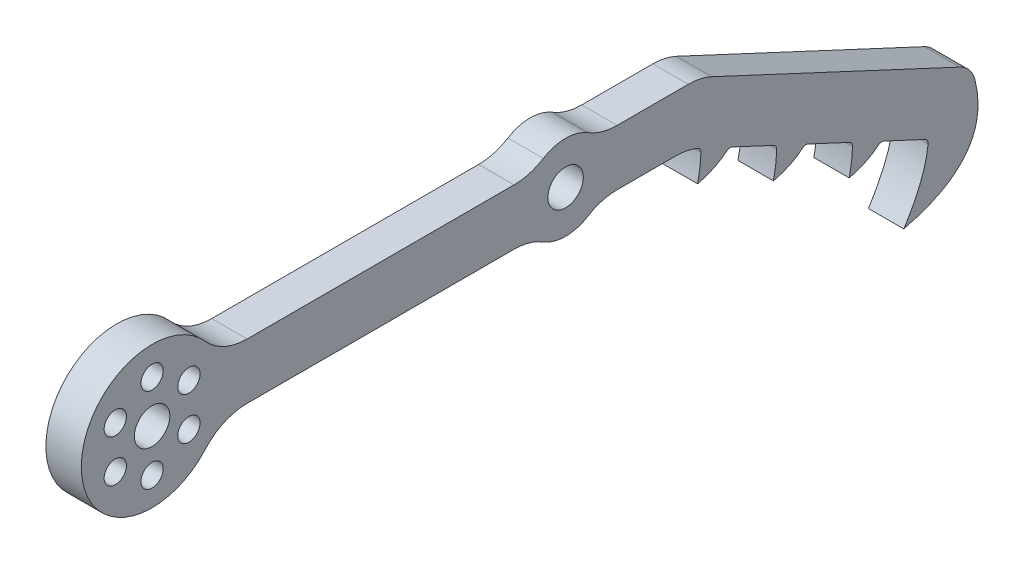
from build123d import *

# Parameters (mm, degrees)
BOSS_EXTRUDE1_DEPTH        = 6.35
F_1_4_0_2500_DOWEL_HOLE4_D = 6.35
FILLET1_R                  = 10
FILLET2_R                  = 10
FILLET4_R                  = 5
FILLET5_R                  = 1
FILLET6_R                  = 10
F_4_0MM_DOWEL_HOLE1_D      = 4
CIRPATTERN1_COUNT          = 6


with BuildPart() as part:
    # Sketch1 → Boss-Extrude1 (new body)
    with BuildSketch(Plane(origin=(0, 0, 0), x_dir=(0, 0, -1), z_dir=(1, 0, 0))):
        with BuildLine():
            Line((-28.374994089, 49.86223243), (28.354545267, 49.86223243))
            ThreePointArc((28.354545267, 49.86223243), (34.104710482, 47.24223243), (39.854875697, 49.86223243))
            Line((39.854875697, 49.86223243), (56.104710487, 49.86223243))
            Line((56.104710487, 49.86223243), (58.379362515, 48.80154477))
            add(Edge.make_bspline(
                [(58.379362515, 48.80154477), (58.386228757, 46.363071997), (57.773854653, 43.567008128)],
                knots=[0, 0, 0, 1, 1, 1], degree=2))
            add(Edge.make_bspline(
                [(63.433148606, 46.444925613), (61.354068213, 44.407555536), (57.773854653, 43.567008128)],
                knots=[0.61808465, 0.61808465, 0.61808465, 1, 1, 1], degree=2))
            Line((63.433148606, 46.444925613), (71.973979321, 42.462270844))
            add(Edge.make_bspline(
                [(71.973979321, 42.462270844), (71.980845562, 40.023798071), (71.368471459, 37.227734202)],
                knots=[0, 0, 0, 1, 1, 1], degree=2))
            add(Edge.make_bspline(
                [(77.027765412, 40.105651687), (74.948685018, 38.06828161), (71.368471459, 37.227734202)],
                knots=[0.61808465, 0.61808465, 0.61808465, 1, 1, 1], degree=2))
            Line((77.027765412, 40.105651687), (85.568596126, 36.122996918))
            add(Edge.make_bspline(
                [(85.568596126, 36.122996918), (85.575462368, 33.684524145), (84.963088264, 30.888460276)],
                knots=[0, 0, 0, 1, 1, 1], degree=2))
            add(Edge.make_bspline(
                [(90.622382217, 33.766377761), (88.543301824, 31.729007684), (84.963088264, 30.888460276)],
                knots=[0.61808465, 0.61808465, 0.61808465, 1, 1, 1], degree=2))
            Line((90.622382217, 33.766377761), (99.163212932, 29.783722992))
            add(Edge.make_bspline(
                [(99.163212932, 29.783722992), (98.939072146, 24.65005498), (94.755179462, 18.075155142)],
                knots=[0, 0, 0, 1, 1, 1], degree=2))
            add(Edge.make_bspline(
                [(94.755179462, 18.075155142), (112.208752339, 22.33534385), (106.773416656, 37.268805905)],
                knots=[0.444949083, 0.444949083, 0.444949083, 1.444949083, 1.444949083, 1.444949083], degree=2))
            Line((106.773416656, 37.268805905), (58.321657114, 59.86223243))
            Line((58.321657114, 59.86223243), (39.854875697, 59.86223243))
            ThreePointArc((39.854875697, 59.86223243), (34.104710482, 62.48223243), (28.354545266, 59.86223243))
            Line((28.354545266, 59.86223243), (-28.374994089, 59.86223243))
            ThreePointArc((-28.374994089, 59.86223243), (-52.749324906, 54.86223243), (-28.374994089, 49.86223243))
        make_face()
    extrude(amount=BOSS_EXTRUDE1_DEPTH)

    # 1/4 (0.2500) Dowel Hole4 (through all)
    with Locations(Plane(origin=(6.35, 0, 0), x_dir=(0, 0, -1), z_dir=(1, 0, 0))):
        with Locations((-40.049324906, 54.86223243), (34.104710482, 54.86223243)):
            Hole(F_1_4_0_2500_DOWEL_HOLE4_D / 2)

    # Fillet1
    fillet1_edges = [part.edges().sort_by_distance(p)[0] for p in [
        (3.175, 59.86223243, 28.374994089),
        (3.175, 49.86223243, 28.374994089),
    ]]
    fillet(fillet1_edges, radius=FILLET1_R)

    # Fillet2
    fillet2_edges = [part.edges().sort_by_distance(p)[0] for p in [
        (3.175, 49.86223243, -56.104710487),
        (3.175, 59.86223243, -58.321657114),
    ]]
    fillet(fillet2_edges, radius=FILLET2_R)

    # Fillet4
    fillet4_edges = [part.edges().sort_by_distance(p)[0] for p in [
        (3.175, 37.268805905, -106.773416656),
    ]]
    fillet(fillet4_edges, radius=FILLET4_R)

    # Fillet5
    fillet5_edges = [part.edges().sort_by_distance(p)[0] for p in [
        (3.175, 33.766377761, -90.622382217),
        (3.175, 40.105651687, -77.027765412),
        (3.175, 46.444925613, -63.433148606),
        (3.175, 48.80154477, -58.379362515),
        (3.175, 42.462270844, -71.973979321),
        (3.175, 36.122996918, -85.568596126),
        (3.175, 29.783722992, -99.163212932),
    ]]
    fillet(fillet5_edges, radius=FILLET5_R)

    # Fillet6
    fillet6_edges = [part.edges().sort_by_distance(p)[0] for p in [
        (3.175, 49.86223243, -28.354545267),
        (3.175, 49.86223243, -39.854875697),
        (3.175, 59.86223243, -28.354545266),
        (3.175, 59.86223243, -39.854875697),
    ]]
    fillet(fillet6_edges, radius=FILLET6_R)

    # Ø4.0mm Dowel Hole1 (through all)
    with Locations(Plane(origin=(6.35, 0, 0), x_dir=(0, 0, -1), z_dir=(1, 0, 0))):
        with Locations((-40.049324906, 62.48223243), (-40.049324906, 54.86223243)):
            f_4_0mm_dowel_hole1 = Hole(F_4_0MM_DOWEL_HOLE1_D / 2)

    # CirPattern1: Ø4.0mm Dowel Hole1 ×6 about axis
    cirpattern1_axis = Axis((6.35, 54.86223243, 40.049324906), (1, 0, 0))
    for i in range(1, CIRPATTERN1_COUNT):
        add(f_4_0mm_dowel_hole1.rotate(cirpattern1_axis, i * 360 / CIRPATTERN1_COUNT), mode=Mode.SUBTRACT)


solid = part.part
